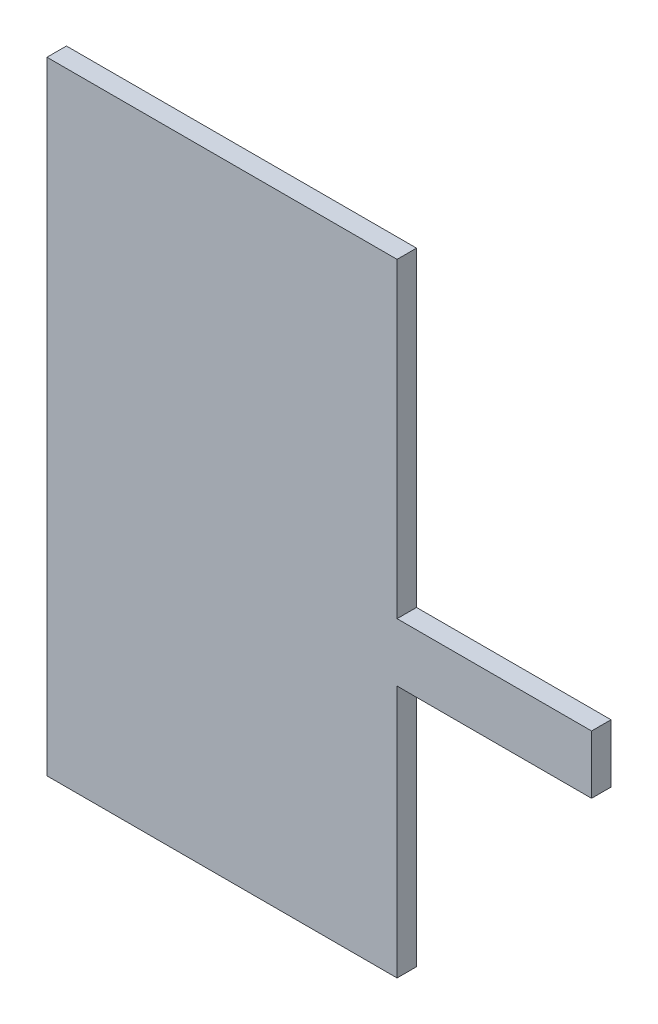
from build123d import *

# Parameters (mm, degrees)
BOSS_EXTRUDE1_DEPTH = 1


with BuildPart() as part:
    # Sketch1 → Boss-Extrude1 (new body)
    with BuildSketch(Plane.XY):
        Polygon((29.736292646, -7), (11.736292646, -7), (11.736292646, 25), (29.736292646, 25), (29.736292646, 9), (39.736292646, 9), (39.736292646, 6), (29.736292646, 6), align=None)
    extrude(amount=BOSS_EXTRUDE1_DEPTH)


solid = part.part
